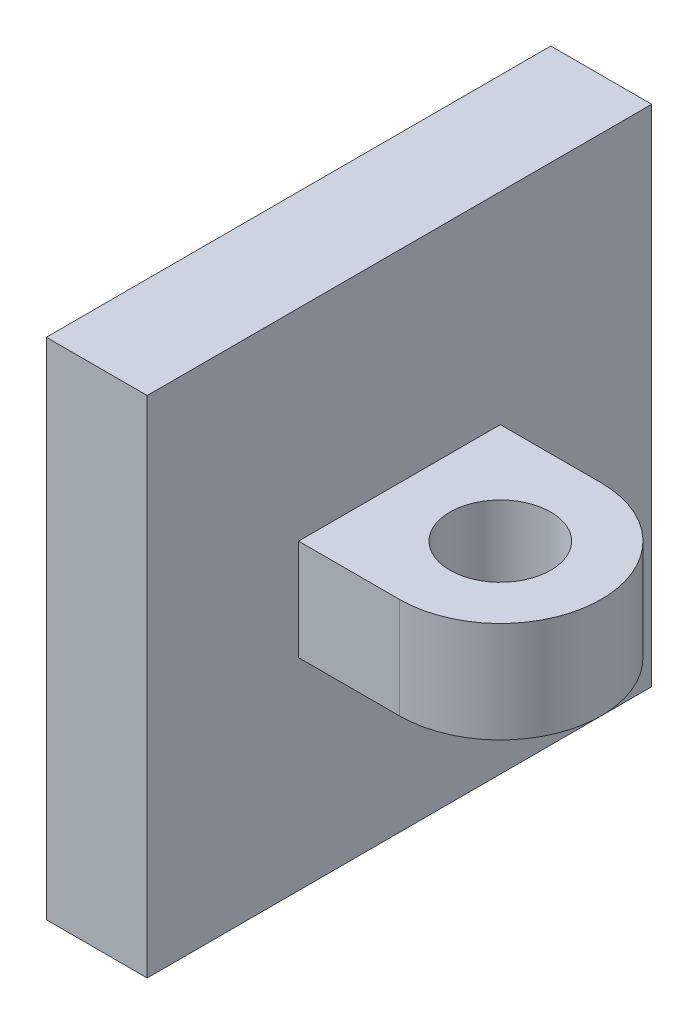
from build123d import *

# Parameters (mm, degrees)
SKETCH1_W           = 2
SKETCH1_H           = 10
BOSS_EXTRUDE1_DEPTH = 10
SKETCH2_W           = 4
SKETCH2_H           = 2
BOSS_EXTRUDE2_DEPTH = 5
SKETCH3_R           = 1
CUT_EXTRUDE1_DEPTH  = 15


with BuildPart() as part:
    # Sketch1 → Boss-Extrude1 (new body)
    with BuildSketch(Plane(origin=(0, 0, 0), x_dir=(1, 0, 0), z_dir=(0, 1, 0))):
        with Locations((0.229885057, -3.379310345)):
            Rectangle(SKETCH1_W, SKETCH1_H)
    extrude(amount=BOSS_EXTRUDE1_DEPTH)

    # Sketch2 → Boss-Extrude2 (add)
    with BuildSketch(Plane(origin=(1.229885057, 0, 0), x_dir=(0, 0, -1), z_dir=(1, 0, 0))):
        with Locations((-3.379310345, 5)):
            Rectangle(SKETCH2_W, SKETCH2_H)
    extrude(amount=BOSS_EXTRUDE2_DEPTH)

    # Sketch3 → Cut-Extrude1 (cut)
    with BuildSketch(Plane(origin=(0, 6, 0), x_dir=(1, 0, 0), z_dir=(0, 1, 0))):
        with BuildLine():
            Line((6.229885057, -5.379310345), (6.229885057, -1.379310345))
            Line((6.229885057, -1.379310345), (3.229885057, -1.379310345))
            ThreePointArc((3.229885057, -1.379310345), (5.229885057, -3.379310345), (3.229885057, -5.379310345))
            Line((3.229885057, -5.379310345), (6.229885057, -5.379310345))
        make_face()
        with Locations((3.229885057, -3.379310345)):
            Circle(SKETCH3_R)
    extrude(amount=-CUT_EXTRUDE1_DEPTH, mode=Mode.SUBTRACT)


solid = part.part
